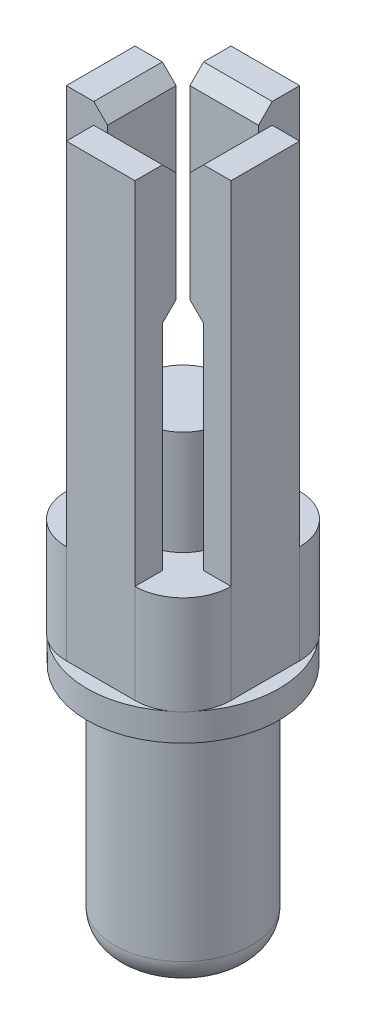
from build123d import *

# Parameters (mm, degrees)
SKETCH_1_R               = 2.5
EXTRUDE_1_DEPTH          = 8.1
SKETCH_4_R               = 3.5
EXTRUDE_2_DEPTH          = 1
EXTRUDE_3_DEPTH          = 11.4
SKETCH_6_W               = 2.5
SKETCH_6_H               = 1.5
EXTRUDE_4_DEPTH          = 5
CUT_EXTRUDE_2_DEPTH      = 2.5
CUT_EXTRUDE_3_DEPTH      = 2.5
PATTERN_CIRCULAR_4_COUNT = 4
EXTRUDE_6_DEPTH          = 3.6
SKETCH_15_R              = 1.5
EXTRUDE_7_DEPTH          = 3.8
FILLET_2_R               = 1
FILLET_3_R               = 1.75


with BuildPart() as part:
    # Эскиз1 → Бобышка-Вытянуть1 (new body)
    with BuildSketch(Plane(origin=(0, 0, 0), x_dir=(1, 0, 0), z_dir=(0, 1, 0))):
        with Locations(Location((0, 0, 0), (0, 0, 270))):
            Circle(SKETCH_1_R)
    extrude(amount=-EXTRUDE_1_DEPTH)

    # По сечениям1: read off the stored shape, not the designer's step
    # По сечениям1: loft between two sections, ruled curve by curve
    loft_1_from = [
        Edge.make_bspline([(0, 0.5, 3.5), (-7, 0.5, 3.5), (-7, 0.5, -3.5), (0, 0.5, -3.5), (7, 0.5, -3.5), (7, 0.5, 3.5), (0, 0.5, 3.5)], [0, 0, 0, 0, 0.5, 0.5, 0.5, 1, 1, 1, 1], 3, [1, 0.333333333, 0.333333333, 1, 0.333333333, 0.333333333, 1]),
    ]
    loft_1_to = [
        Edge.make_bspline([(-1.133576436, 0, 2.228228997), (-5.59003443, 0, -0.038923874), (-3.322881559, 0, -4.495381869), (1.133576436, 0, -2.228228997), (5.59003443, 0, 0.038923874), (3.322881559, 0, 4.495381869), (-1.133576436, 0, 2.228228997)], [0, 0, 0, 0, 0.5, 0.5, 0.5, 1, 1, 1, 1], 3, [1, 0.333333333, 0.333333333, 1, 0.333333333, 0.333333333, 1]),
    ]
    loft_1 = Solid(Shell([*[Face.make_surface_from_curves(loft_1_from[k], loft_1_to[k]) for k in range(1)], Face(Wire(loft_1_from)), Face(Wire(loft_1_to))]))
    add(loft_1)

    # Эскиз4 → Бобышка-Вытянуть2 (add)
    with BuildSketch(Plane(origin=(0, 0.5, 0), x_dir=(1, 0, 0), z_dir=(0, 1, 0))):
        with Locations(Location((0, 0, 0), (0, 0, 270))):
            Circle(SKETCH_4_R)
    extrude(amount=EXTRUDE_2_DEPTH)

    # Эскиз5 → Бобышка-Вытянуть3 (add)
    with BuildSketch(Plane(origin=(0, 1.5, 0), x_dir=(1, 0, 0), z_dir=(0, 1, 0))):
        Polygon((1.25, 2.5), (1.25, 2), (-1.25, 2), (-1.25, 2.5), (-1.25, 3), (1.25, 3), align=None)
    extrude_3 = extrude(amount=EXTRUDE_3_DEPTH)

    # Эскиз6 → Бобышка-Вытянуть4 (add)
    with BuildSketch(Plane(origin=(0, 12.9, 0), x_dir=(1, 0, 0), z_dir=(0, 1, 0))):
        with Locations((0, 2.25)):
            Rectangle(SKETCH_6_W, SKETCH_6_H)
    extrude_4 = extrude(amount=EXTRUDE_4_DEPTH)

    # Эскиз8 → Вырез-Вытянуть2 (cut)
    with BuildSketch(Plane(origin=(1.25, 0, 0), x_dir=(0, 0, -1), z_dir=(1, 0, 0))):
        Polygon((1.5, 12.9), (2, 12.9), (1.5, 13.4), align=None)
    cut_extrude_2 = extrude(amount=-CUT_EXTRUDE_2_DEPTH, mode=Mode.SUBTRACT)

    # Эскиз9 → Вырез-Вытянуть3 (cut)
    with BuildSketch(Plane(origin=(1.25, 0, 0), x_dir=(0, 0, -1), z_dir=(1, 0, 0))):
        Polygon((1.5, 17.9), (1.5, 17.4), (2, 17.9), align=None)
    cut_extrude_3 = extrude(amount=-CUT_EXTRUDE_3_DEPTH, mode=Mode.SUBTRACT)

    # Круговой массив4: Бобышка-Вытянуть3, Бобышка-Вытянуть4, Вырез-Вытянуть2, Вырез-Вытянуть3 ×4 about axis
    pattern_circular_4_axis = Axis((0, 0, 0), (0, 1, 0))
    add([extrude_3.rotate(pattern_circular_4_axis, i * 360 / PATTERN_CIRCULAR_4_COUNT) for i in range(1, PATTERN_CIRCULAR_4_COUNT)])
    add([extrude_4.rotate(pattern_circular_4_axis, i * 360 / PATTERN_CIRCULAR_4_COUNT) for i in range(1, PATTERN_CIRCULAR_4_COUNT)])
    add([cut_extrude_2.rotate(pattern_circular_4_axis, i * 360 / PATTERN_CIRCULAR_4_COUNT) for i in range(1, PATTERN_CIRCULAR_4_COUNT)], mode=Mode.SUBTRACT)
    add([cut_extrude_3.rotate(pattern_circular_4_axis, i * 360 / PATTERN_CIRCULAR_4_COUNT) for i in range(1, PATTERN_CIRCULAR_4_COUNT)], mode=Mode.SUBTRACT)

    # Эскиз14 → Бобышка-Вытянуть6 (add)
    with BuildSketch(Plane(origin=(0, 1.5, 0), x_dir=(1, 0, 0), z_dir=(0, 1, 0))):
        Polygon((0, 3), (3, 3), (3, -3), (-3, -3), (-3, 3), align=None)
    extrude(amount=EXTRUDE_6_DEPTH)

    # Эскиз15 → Бобышка-Вытянуть7 (add)
    with BuildSketch(Plane(origin=(0, 5.1, 0), x_dir=(1, 0, 0), z_dir=(0, 1, 0))):
        with Locations(Location((0, 0, 0), (0, 0, 90))):
            Circle(SKETCH_15_R)
    extrude(amount=EXTRUDE_7_DEPTH)

    # Скругление2
    fillet_2_edges = [part.edges().sort_by_distance(p)[0] for p in [
        (0, -8.1, -2.5),
    ]]
    fillet(fillet_2_edges, radius=FILLET_2_R)

    # Скругление3
    # the kernel refuses this fillet: 1.75 mm, written as the material it takes off along each edge
    with BuildSketch(Plane(origin=(-3, 1.5, -3), x_dir=(0, 0, 1), z_dir=(0, 1, 0)), Plane(origin=(3, 1.5, -3), x_dir=(-1, 0, 0), z_dir=(0, 1, 0)), Plane(origin=(-3, 1.5, 3), x_dir=(1, 0, 0), z_dir=(0, 1, 0))) as fillet_3_piece_1:
        with BuildLine():
            CenterArc((FILLET_3_R, FILLET_3_R), FILLET_3_R, 180, 90)
            Line((0, FILLET_3_R), (0, 0))
            Line((0, 0), (FILLET_3_R, 0))
        make_face()
    extrude(amount=7.975, mode=Mode.SUBTRACT)
    with BuildSketch(Plane(origin=(3, 1.5, 3), x_dir=(-1, 0, 0), z_dir=(0, 1, 0))) as fillet_3_piece_2:
        with BuildLine():
            CenterArc((FILLET_3_R, -FILLET_3_R), FILLET_3_R, 90, 90)
            Line((0, -FILLET_3_R), (0, 0))
            Line((0, 0), (FILLET_3_R, 0))
        make_face()
    extrude(amount=7.975, mode=Mode.SUBTRACT)


solid = part.part
